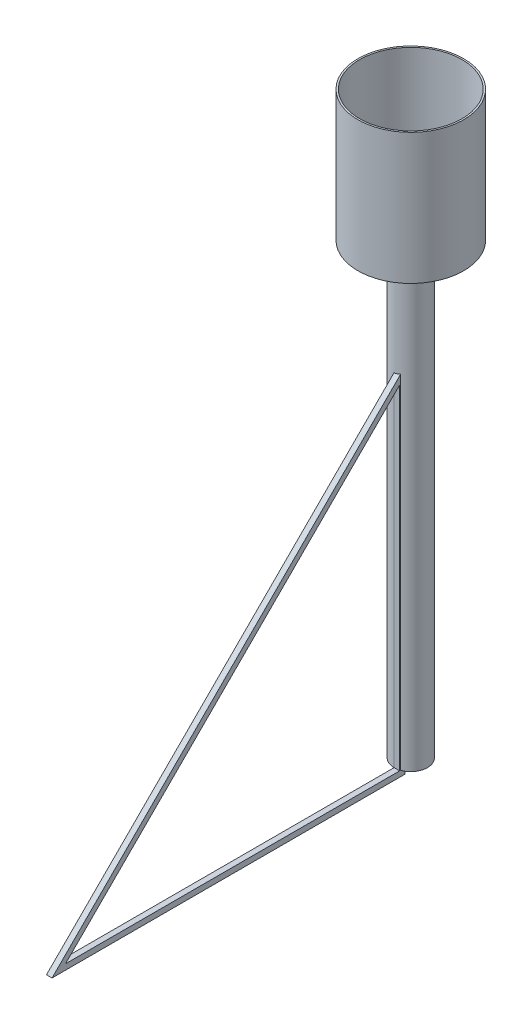
from build123d import *

# Parameters (mm, degrees)
SKETCH1_R           = 95
BOSS_EXTRUDE1_DEPTH = 235
SKETCH2_R           = 30
BOSS_EXTRUDE2_DEPTH = 805
SHELL1_T            = -3
EXTRUDE_THIN1_DEPTH = 10


with BuildPart() as part:
    # Sketch1 → Boss-Extrude1 (new body)
    with BuildSketch(Plane(origin=(0, 0, 0), x_dir=(1, 0, 0), z_dir=(0, 1, 0))):
        Circle(SKETCH1_R)
    extrude(amount=BOSS_EXTRUDE1_DEPTH)

    # Sketch2 → Boss-Extrude2 (add)
    with BuildSketch(Plane.XZ):
        Circle(SKETCH2_R)
    extrude(amount=BOSS_EXTRUDE2_DEPTH)

    # Shell1
    shell1_openings = [part.faces().sort_by_distance(p)[0] for p in [
        (0, 235, 0),
        (0, -805, 0),
    ]]
    offset(amount=SHELL1_T, openings=shell1_openings, kind=Kind.INTERSECTION)


with BuildPart() as body_2:
    # Sketch10 → Extrude-Thin1 (new body)
    with BuildSketch(Plane(origin=(0, 0, 0), x_dir=(0, 0, -1), z_dir=(1, 0, 0))):
        Polygon((-20, -180.857864376), (-654.142135624, -815), (-20, -815), align=None)
        Polygon((-30, -205), (-630, -805), (-30, -805), align=None, mode=Mode.SUBTRACT)
    extrude(amount=EXTRUDE_THIN1_DEPTH)


solid = Compound([part.part, body_2.part])
